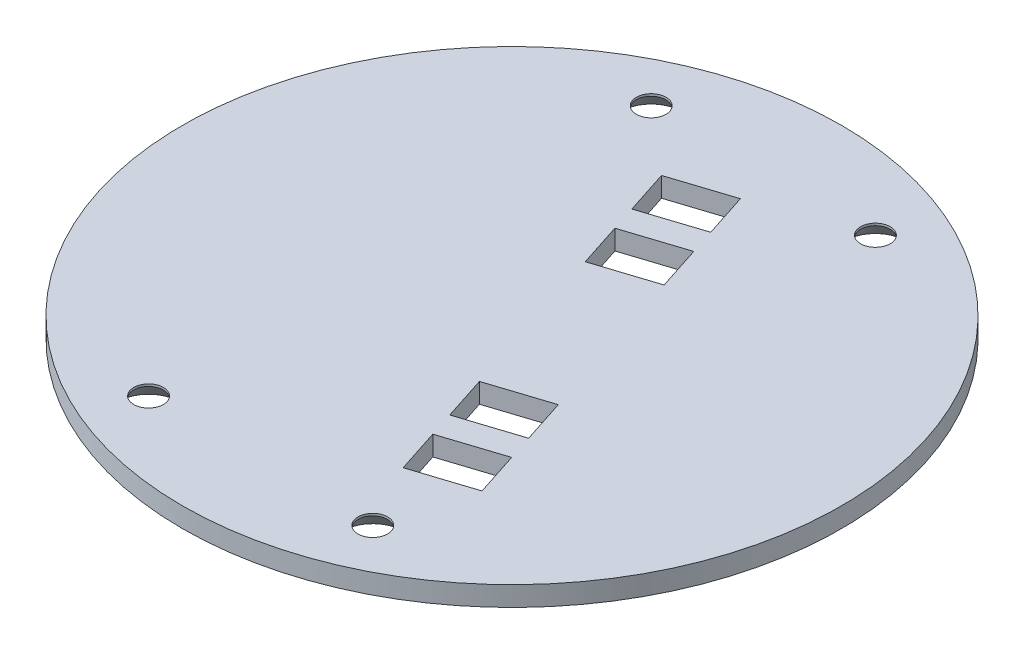
from build123d import *

# Parameters (mm, degrees)
A_BASE_T_START                                = -1.5
A_BASE_T_OUTLINE_R                            = 47
A_BASE_T_OUTLINE_R_2                          = 1
A_BASE_T_DEPTH                                = 3
BASE_PULLEY_CUTOUT_DEPTH                      = 67.535704701
OUTER_START                                   = -3
SKETCH2_R                                     = 50
SKETCH2_R_2                                   = 47
OUTER_RING_DEPTH                              = 3
PATCHING_START                                = -3
SKETCH3_R                                     = 1
PATCHING_DEPTH                                = 3
CSK_FOR_8_FLAT_HEAD_SOCKET_CAP_SCREW1_A_COUNT = 2
CSK_FOR_8_FLAT_HEAD_SOCKET_CAP_SCREW1_A_PITCH = 34.018518517
CSK_FOR_8_FLAT_HEAD_SOCKET_CAP_SCRE_2_COUNT   = 2
CSK_FOR_8_FLAT_HEAD_SOCKET_CAP_SCRE_2_PITCH   = 83.5
CSK_FOR_8_FLAT_HEAD_SOCKET_CAP_SCRE_3_COUNT   = 2
CSK_FOR_8_FLAT_HEAD_SOCKET_CAP_SCRE_3_PITCH   = 76.256084334


# Read off the part's stored shape, not the designer's step: a_base_t
with BuildPart() as part:
    # a_base_t outline → a_base_t (new body)
    with BuildSketch(Plane(origin=(0, 0, 0), x_dir=(1, 0, 0), z_dir=(0, 1, 0)).offset(A_BASE_T_START)):
        Circle(A_BASE_T_OUTLINE_R)
        with Locations((-17.009259258, -38.128042167)):
            Circle(A_BASE_T_OUTLINE_R_2, mode=Mode.SUBTRACT)
        with Locations((-9.166666665, -28.284271247)):
            Circle(A_BASE_T_OUTLINE_R_2, mode=Mode.SUBTRACT)
        with Locations((17.009259258, -38.128042167)):
            Circle(A_BASE_T_OUTLINE_R_2, mode=Mode.SUBTRACT)
        with Locations((27.5, -28.284271247)):
            Circle(A_BASE_T_OUTLINE_R_2, mode=Mode.SUBTRACT)
        with Locations((-27.5, 28.284271247)):
            Circle(A_BASE_T_OUTLINE_R_2, mode=Mode.SUBTRACT)
        with Locations((-17.009259258, 38.128042167)):
            Circle(A_BASE_T_OUTLINE_R_2, mode=Mode.SUBTRACT)
        with Locations((9.166666665, 28.284271247)):
            Circle(A_BASE_T_OUTLINE_R_2, mode=Mode.SUBTRACT)
        with Locations((17.009259258, 38.128042167)):
            Circle(A_BASE_T_OUTLINE_R_2, mode=Mode.SUBTRACT)
    extrude(amount=A_BASE_T_DEPTH)

    # Sketch1 → Base Pulley Cutout (cut, through all)
    with BuildSketch(Plane(origin=(0, 1.5, 0), x_dir=(1, 0, 0), z_dir=(0, 1, 0))):
        Polygon((8.337949793, -17.780503881), (17.375186195, -14.85162044), (15.217061554, -8.192604143), (6.179825152, -11.121487584), align=None)
        Polygon((9.571163873, -21.58565605), (18.608400275, -18.656772609), (20.766524916, -25.315788906), (11.729288514, -28.244672346), align=None)
        Polygon((7.518722658, 15.561058274), (-1.518513745, 12.632174833), (-3.676638385, 19.291191129), (5.360598017, 22.22007457), align=None)
        Polygon((-4.909852466, 23.096343299), (4.127383937, 26.025226739), (1.969259296, 32.684243036), (-7.067977106, 29.755359595), align=None)
    extrude(amount=-BASE_PULLEY_CUTOUT_DEPTH, mode=Mode.SUBTRACT)

    # Sketch2 → Outer Ring (add)
    with BuildSketch(Plane(origin=(0, 1.5, 0), x_dir=(1, 0, 0), z_dir=(0, 1, 0)).offset(OUTER_START)):
        with Locations(Location((0, 0, 0), (0, 0, 270))):
            Circle(SKETCH2_R)
        Circle(SKETCH2_R_2, mode=Mode.SUBTRACT)
    extrude(amount=OUTER_RING_DEPTH)

    # Sketch3 → Patching (add)
    with BuildSketch(Plane(origin=(0, 1.5, 0), x_dir=(1, 0, 0), z_dir=(0, 1, 0)).offset(PATCHING_START)):
        with Locations((-9.166666665, -28.284271247)):
            Circle(SKETCH3_R)
        with Locations((-27.5, 28.284271247)):
            Circle(SKETCH3_R)
        with Locations((9.166666665, 28.284271247)):
            Circle(SKETCH3_R)
        with Locations((27.5, -28.284271247)):
            Circle(SKETCH3_R)
    extrude(amount=PATCHING_DEPTH)

    # Sketch6 → CSK for #8 Flat Head Socket Cap Screw1 (revolve, cut)
    with BuildSketch(Plane(origin=(17.009259258, -1.5, 38.128042167), x_dir=(0, 0, -1), z_dir=(1, 0, 0))):
        Polygon((0, 0), (0, 3), (2.2479, 3), (2.2479, 2.658961536), (4.5593, 0), align=None)
    csk_for_8_flat_head_socket_cap_screw1 = revolve(axis=Axis((17.009259258, -7.85, 38.128042167), (0, 1, 0)), mode=Mode.SUBTRACT)

    # CSK for #8 Flat Head Socket Cap Screw1 a: CSK for #8 Flat Head Socket Cap Screw1 ×2
    with Locations(*[(-i * CSK_FOR_8_FLAT_HEAD_SOCKET_CAP_SCREW1_A_PITCH, 0, 0) for i in range(1, CSK_FOR_8_FLAT_HEAD_SOCKET_CAP_SCREW1_A_COUNT)]):
        add(csk_for_8_flat_head_socket_cap_screw1, mode=Mode.SUBTRACT)

    # CSK for _8 Flat Head Socket Cap Scre 2: CSK for #8 Flat Head Socket Cap Screw1 ×2
    with Locations(*[Vector(-0.40740740738888753, 0, -0.9132465189666288) * (i * CSK_FOR_8_FLAT_HEAD_SOCKET_CAP_SCRE_2_PITCH) for i in range(1, CSK_FOR_8_FLAT_HEAD_SOCKET_CAP_SCRE_2_COUNT)]):
        add(csk_for_8_flat_head_socket_cap_screw1, mode=Mode.SUBTRACT)

    # CSK for _8 Flat Head Socket Cap Scre 3: CSK for #8 Flat Head Socket Cap Screw1 ×2
    with Locations(*[(0, 0, -i * CSK_FOR_8_FLAT_HEAD_SOCKET_CAP_SCRE_3_PITCH) for i in range(1, CSK_FOR_8_FLAT_HEAD_SOCKET_CAP_SCRE_3_COUNT)]):
        add(csk_for_8_flat_head_socket_cap_screw1, mode=Mode.SUBTRACT)


solid = part.part
